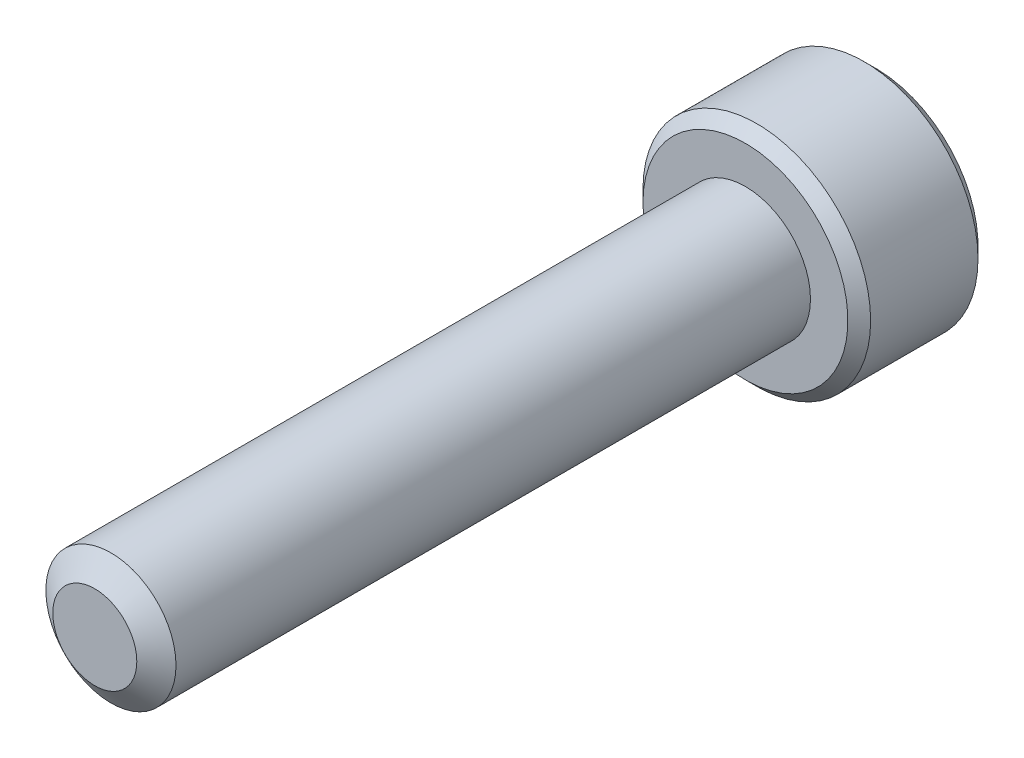
from build123d import *

# Parameters (mm, degrees)
SKETCH1_R          = 2
EXTRUDE1_DEPTH     = 20
SKETCH6_R          = 3.5
EXTRUDE2_DEPTH     = 4
CUT_EXTRUDE1_DEPTH = 2.25
CHAMFER1_SIZE      = 0.35


with BuildPart() as part:
    # Sketch1 → Extrude1 (new body)
    with BuildSketch(Plane.XY):
        Circle(SKETCH1_R)
    extrude(amount=-EXTRUDE1_DEPTH)

    # Sketch4 → Cut-Revolve1 (revolve, cut)
    with BuildSketch(Plane(origin=(0, 0, 0), x_dir=(0, 0, -1), z_dir=(1, 0, 0))):
        Polygon((0.496211411, 2), (0, 1.291336663), (0, 2), align=None)
    revolve(axis=Axis((0, 0, 0), (0, 0, -1)), mode=Mode.SUBTRACT)

    # Sketch6 → Extrude2 (add)
    with BuildSketch(Plane(origin=(0, 0, -20), x_dir=(-1, 0, 0), z_dir=(0, 0, -1))):
        Circle(SKETCH6_R)
    extrude(amount=EXTRUDE2_DEPTH)

    # Sketch7 → Cut-Extrude1 (cut)
    with BuildSketch(Plane(origin=(0, 0, -24), x_dir=(-1, 0, 0), z_dir=(0, 0, -1))):
        Polygon((0, 1.732050808), (-1.5, 0.866025404), (-1.5, -0.866025404), (0, -1.732050808), (1.5, -0.866025404), (1.5, 0.866025404), align=None)
    extrude(amount=-CUT_EXTRUDE1_DEPTH, mode=Mode.SUBTRACT)

    # Cut-Extrude2 cone 1 section (through the dimple's axis) → Cut-Extrude2 (revolve, cut)
    with BuildSketch(Plane(origin=(0, 0, -24), x_dir=(0, 1, 0), z_dir=(1, 0, 0))):
        Polygon((0, 0), (1.732050808, 0), (0, 1.732050808), align=None)
    revolve(axis=Axis((0, 0, -24), (0, 0, 1)), mode=Mode.SUBTRACT)

    # Chamfer1
    chamfer1_edges = [part.edges().sort_by_distance(p)[0] for p in [
        (3.5, 0, -24),
        (3.5, 0, -20),
    ]]
    chamfer(chamfer1_edges, length=CHAMFER1_SIZE)


solid = part.part
